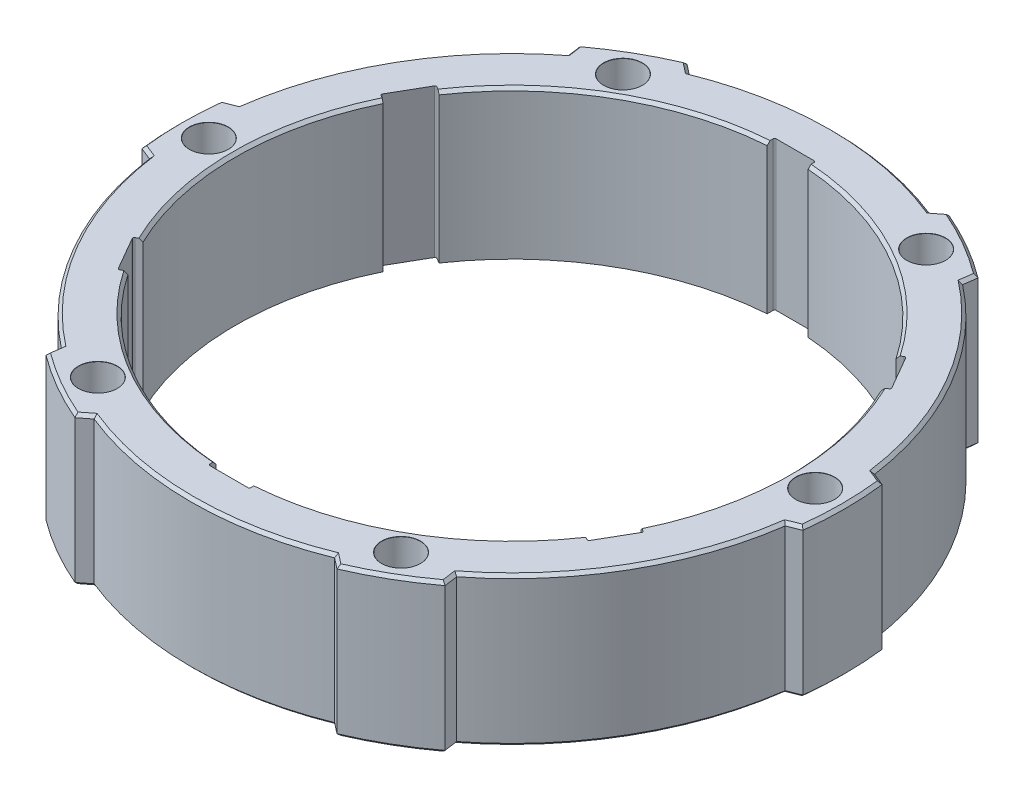
from build123d import *

# Parameters (mm, degrees)
BODY_SKETCH_R                           = 56
BODY_SKETCH_R_2                         = 46.5
BODY_DEPTH                              = 25
SIDE_CUTOUTS_DEPTH                      = 84.04817878797824
DRIVING_CUTOUT_DEPTH                    = 84.04817878797826
DRIVING_CUTOUT_FILLET_R                 = 0.25
MAIN_PATTERN_COUNT                      = 6
DRIVING_CUTOUT_FILLET_OF_MAIN_PATTERN_R = 0.25
OVERALL_CHAMFER_SIZE                    = 0.5


with BuildPart() as part:
    # body_sketch → body (new body)
    with BuildSketch(Plane(origin=(0, 0, 0), x_dir=(1, 0, 0), z_dir=(0, 1, 0))):
        Circle(BODY_SKETCH_R)
        Circle(BODY_SKETCH_R_2, mode=Mode.SUBTRACT)
    extrude(amount=BODY_DEPTH)

    # Sketch4 → spring_screw_hole (revolve, cut)
    with BuildSketch(Plane(origin=(51, 25, 0), x_dir=(0, 0, 1), z_dir=(1, 0, 0))):
        Polygon((0, 0), (-6.12e-15, 25), (1.6999999999999937, 25), (1.6999999999999953, 20), (3.249999999999998, 20), (3.2499999999999996, 0.02500000000000014), (3.2750000000000004, -3.47e-15), align=None)
    spring_screw_hole = revolve(axis=Axis((51, 31.34999999999999, 0), (0, -1, 0)), mode=Mode.SUBTRACT)

    # Sketch5 → side_cutouts (cut, through all)
    with BuildSketch(Plane(origin=(0, 25, 0), x_dir=(1, 0, 0), z_dir=(0, 1, 0))):
        with BuildLine():
            Line((53.474475712044786, 7.515347451843559), (55.6031178344905, 6.65532020895809))
            ThreePointArc((55.6031178344905, 6.65532020895809), (48.49742261192851, 28.000000000000078), (33.56523528852275, 44.82605246980941))
            Line((33.56523528852275, 44.82605246980941), (33.24571966758543, 42.55258069476307))
            ThreePointArc((33.24571966758543, 42.55258069476307), (46.76537180435964, 27.000000000000075), (53.474475712044786, 7.515347451843559))
        make_face()
    side_cutouts = extrude(amount=-SIDE_CUTOUTS_DEPTH, mode=Mode.SUBTRACT)

    # Sketch6 → driving_cutout (cut, through all)
    with BuildSketch(Plane(origin=(0, 25, 0), x_dir=(1, 0, 0), z_dir=(0, 1, 0))):
        Polygon((41.88246812850031, 20.201704469305465), (38.43642333441421, 26.17042913782078), (39.518955089144754, 26.79542913782078), (42.96499988323085, 20.82670446930547), align=None)
    driving_cutout = extrude(amount=-DRIVING_CUTOUT_DEPTH, mode=Mode.SUBTRACT)

    # driving_cutout_fillet
    driving_cutout_fillet_edges = [part.edges().sort_by_distance(p)[0] for p in [
        (42.96499988323085, 12.5, -20.82670446930547),
        (39.518955089144754, 12.5, -26.79542913782078),
    ]]
    fillet(driving_cutout_fillet_edges, radius=DRIVING_CUTOUT_FILLET_R)

    # main_pattern: spring_screw_hole, side_cutouts, driving_cutout ×6 about axis
    main_pattern_axis = Axis((0, 25, 0), (0, 1, 0))
    add([spring_screw_hole.rotate(main_pattern_axis, i * 360 / MAIN_PATTERN_COUNT) for i in range(1, MAIN_PATTERN_COUNT)], mode=Mode.SUBTRACT)
    add([side_cutouts.rotate(main_pattern_axis, i * 360 / MAIN_PATTERN_COUNT) for i in range(1, MAIN_PATTERN_COUNT)], mode=Mode.SUBTRACT)
    add([driving_cutout.rotate(main_pattern_axis, i * 360 / MAIN_PATTERN_COUNT) for i in range(1, MAIN_PATTERN_COUNT)], mode=Mode.SUBTRACT)

    # driving_cutout_fillet of main_pattern
    driving_cutout_fillet_of_main_pattern_edges = [part.edges().sort_by_distance(p)[0] for p in [
        (3.4460447940859886, 12.5, -47.62213360712609),
        (-3.44604479408617, 12.5, -47.622133607126074),
        (-39.51895508914485, 12.5, -26.795429137820634),
        (-42.964999883230924, 12.5, -20.8267044693053),
        (-42.96499988323085, 12.5, 20.826704469305465),
        (-39.518955089144754, 12.5, 26.795429137820776),
        (-3.44604479408601, 12.5, 47.62213360712609),
        (3.446044794086152, 12.5, 47.622133607126074),
        (39.51895508914487, 12.5, 26.79542913782062),
        (42.96499988323093, 12.5, 20.826704469305284),
    ]]
    fillet(driving_cutout_fillet_of_main_pattern_edges, radius=DRIVING_CUTOUT_FILLET_OF_MAIN_PATTERN_R)

    # overall_chamfer
    overall_chamfer_edges = [part.edges().sort_by_distance(p)[0] for p in [
        (46.765371804359646, 0, -27.000000000000057),
        (54.53879677326765, 0, -7.085333830400824),
        (56, 0, 2.8422e-13),
        (54.53879677326766, -3.55e-15, 7.085333830400639),
        (46.76537180435972, 0, 26.999999999999932),
        (33.405477478054245, 0, 43.68931658228614),
        (28.00000000000033, 0, 48.49742261192837),
        (21.13331929521355, -3.55e-15, 50.77465041268691),
        (3.77e-14, 0, 53.99999999999999),
        (-21.133319295213433, 0, 50.774650412686945),
        (-28.0000000000003, 0, 48.4974226119284),
        (-33.4054774780541, -3.55e-15, 43.689316582286246),
        (-46.76537180435966, 0, 27.00000000000005),
        (-54.53879677326765, 0, 7.085333830400815),
        (-56.00000000000001, 0, -2.7356e-13),
        (-54.53879677326766, 0, -7.085333830400655),
        (-46.76537180435971, 0, -26.99999999999995),
        (-33.40547747805422, 0, -43.68931658228614),
        (-28.000000000000988, 0, -48.497422611928),
        (-21.133319295213568, 1.78e-15, -50.774650412686896),
        (-5.902e-14, 0, -53.99999999999999),
        (21.13331929521342, 0, -50.77465041268697),
        (33.405477478054095, -3.55e-15, -43.68931658228625),
        (28.00000000000028, 0, -48.49742261192841),
        (33.405477478054245, 25, 43.68931658228613),
        (28.00000000000007, 25, 48.49742261192853),
        (21.13331929521354, 25, 50.774650412686896),
        (4.619e-14, 25, 53.99999999999999),
        (-21.133319295213433, 25, 50.774650412686945),
        (-27.999999999999936, 25, 48.497422611928606),
        (-33.4054774780541, 25, 43.68931658228623),
        (-46.765371804359646, 25, 27.000000000000057),
        (-54.53879677326764, 25, 7.085333830400817),
        (-56, 25, 9.592e-14),
        (-54.538796773267656, 25, -7.085333830400664),
        (-46.76537180435972, 25, -26.999999999999936),
        (-33.40547747805423, 25, -43.68931658228614),
        (-28.0000000000001, 25, -48.497422611928506),
        (-21.133319295213557, 25, -50.77465041268689),
        (-7.105e-14, 25, -54),
        (21.13331929521341, 25, -50.77465041268696),
        (27.99999999999993, 25, -48.49742261192861),
        (33.405477478054095, 25, -43.68931658228624),
        (46.765371804359646, 25, -27.000000000000064),
        (54.53879677326764, 25, -7.085333830400824),
        (56, 25, -9.504e-14),
        (54.53879677326766, 25, 7.085333830400643),
        (46.765371804359724, 25, 26.99999999999993),
        (-46.5, 25, 9.592e-14),
        (-23.24999999999993, 25, 40.27018127597644),
        (23.250000000000075, 25, 40.27018127597636),
        (46.5, 25, -9.592e-14),
        (23.24999999999989, 25, -40.27018127597647),
        (-23.250000000000068, 25, -40.27018127597637),
    ]]
    chamfer(overall_chamfer_edges, length=OVERALL_CHAMFER_SIZE)


solid = part.part
